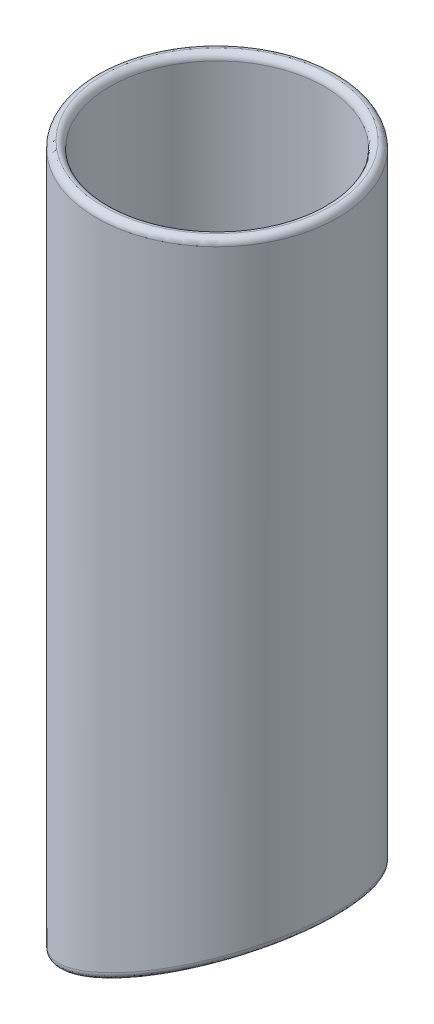
from build123d import *

# Parameters (mm, degrees)
CUT_EXTRUDE1_DEPTH      = 89.074065067
CUT_EXTRUDE1_DEPTH_BACK = 89.074065067
FILLET1_R               = 0.79375


with BuildPart() as part:
    # Sketch1 → Revolve1 (revolve)
    with BuildSketch(Plane.XY, mode=Mode.PRIVATE) as revolve1_sk:
        Polygon((-2.032, 0), (-2.032, 14.23435008), (-4.7625, 15.875), (-12.7, 15.875), (-12.7, 85.725), (-14.2875, 85.725), (-14.2875, 0), align=None)
    revolve(revolve1_sk.sketch.rotate(Axis((0, 0, 0), (0, 1, 0)), 270), axis=Axis((0, 0, 0), (0, 1, 0)))

    # Sketch2 → Cut-Extrude1 (cut, two sides: drawn at the far end of the back side and taken through both)
    with BuildSketch(Plane.XY.offset(-CUT_EXTRUDE1_DEPTH_BACK)):
        Polygon((-14.2875, 0), (14.2875, 13.324741332), (14.2875, 0), align=None)
    extrude(amount=CUT_EXTRUDE1_DEPTH + CUT_EXTRUDE1_DEPTH_BACK, mode=Mode.SUBTRACT)

    # Fillet1
    fillet1_edges = [part.edges().sort_by_distance(p)[0] for p in [
        (-10.102788136, 1.951363189, -10.102788136),
        (0, 85.725, 14.2875),
        (0, 85.725, 12.7),
        (0, 15.875, 12.7),
    ]]
    fillet(fillet1_edges, radius=FILLET1_R - 0.0001)  # a hair under: the kernel refuses the full size


solid = part.part
